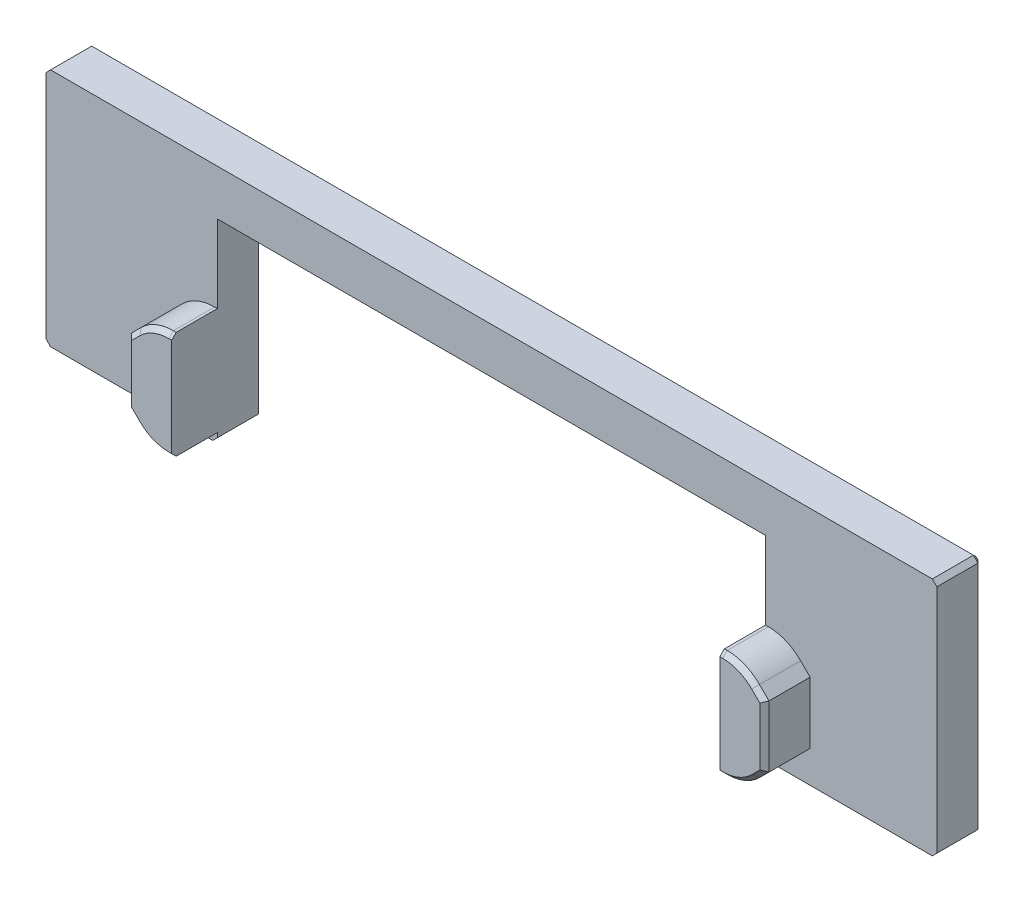
from build123d import *

# Parameters (mm, degrees)
BOSS_EXTRUDE1_DEPTH = 2
BOSS_EXTRUDE3_DEPTH = 2
DEBURS_SIZE         = 0.2


with BuildPart() as part:
    # Sketch1 → Boss-Extrude1 (new body)
    with BuildSketch(Plane.XY):
        Polygon((-19.3, 5.25), (19.3, 5.25), (19.5, 5.05), (19.5, -5.05), (19.3, -5.25), (12.2, -5.25), (12, -5.05), (12, 3.25), (-12, 3.25), (-12, -5.05), (-12.2, -5.25), (-19.3, -5.25), (-19.5, -5.05), (-19.5, 5.05), align=None)
    extrude(amount=-BOSS_EXTRUDE1_DEPTH)

    # Sketch3 → Boss-Extrude3 (add)
    with BuildSketch(Plane.XY):
        with BuildLine():
            Line((12, -0.15), (12, -4.85))
            Line((12, -4.85), (12.121572875, -4.85))
            ThreePointArc((12.121572875, -4.85), (12.88693974, -4.697759065), (13.535786438, -4.264213562))
            Line((13.535786438, -4.264213562), (13.95, -3.85))
            Line((13.95, -3.85), (13.95, -1.15))
            Line((13.95, -1.15), (13.535786438, -0.735786438))
            ThreePointArc((13.535786438, -0.735786438), (12.88693974, -0.302240935), (12.121572875, -0.15))
            Line((12.121572875, -0.15), (12, -0.15))
        make_face()
    boss_extrude3 = extrude(amount=BOSS_EXTRUDE3_DEPTH)

    # Mirror3: Boss-Extrude3 across plane
    add(boss_extrude3.mirror(Plane(origin=(0, 0, 0), x_dir=(0, 0, 1), z_dir=(1, 0, 0))))

    # Deburs
    deburs_edges = [part.edges().sort_by_distance(p)[0] for p in [
        (12, -0.9, -2),
        (12.1, -5.15, -2),
        (15.75, -5.25, -2),
        (19.4, -5.15, -2),
        (19.5, 0, -2),
        (19.4, 5.15, -2),
        (0, 5.25, -2),
        (-19.4, 5.15, -2),
        (-19.5, 0, -2),
        (-19.4, -5.15, -2),
        (-15.75, -5.25, -2),
        (-12.1, -5.15, -2),
        (-12, -0.9, -2),
        (0, 3.25, -2),
        (-12.060786438, -4.85, 2),
        (-13.742893219, -4.057106781, 2),
        (-12.88693974, -4.697759065, 2),
        (-13.95, -2.5, 2),
        (-13.742893219, -0.942893219, 2),
        (-12.060786438, -0.15, 2),
        (-12.88693974, -0.302240935, 2),
        (12.060786438, -4.85, 2),
        (13.742893219, -4.057106781, 2),
        (12.88693974, -4.697759065, 2),
        (13.95, -2.5, 2),
        (13.742893219, -0.942893219, 2),
        (12.060786438, -0.15, 2),
        (12.88693974, -0.302240935, 2),
    ]]
    chamfer(deburs_edges, length=DEBURS_SIZE)


solid = part.part
